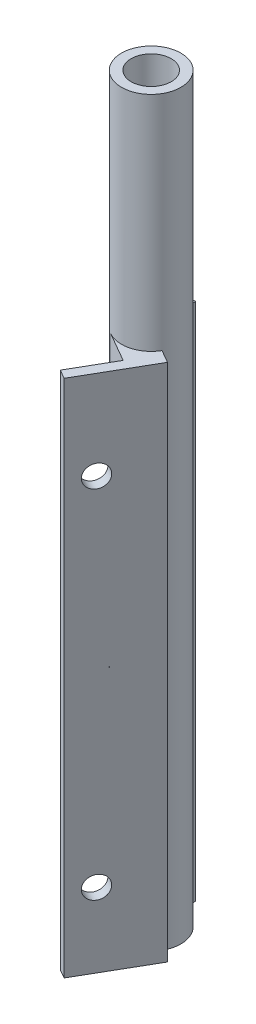
from build123d import *

# Parameters (mm, degrees)
SKETCH1_R           = 5.08
BOSS_EXTRUDE1_DEPTH = 127
SKETCH2_R           = 3.429
CUT_EXTRUDE1_DEPTH  = 128.2030377
BOSS_EXTRUDE2_DEPTH = 88.9
HOLE_CUTS_1_REACH   = 130.439
SKETCH4_R           = 1.905
HOLE_CUTS_2_REACH   = 130.439
SKETCH7_R           = 1.905
CUT_EXTRUDE7_REACH  = 130.439
SKETCH8_W           = 6.604
SKETCH8_H           = 4.572
SKETCH9_W           = 11.684
SKETCH9_H           = 88.9
CUT_EXTRUDE8_DEPTH  = 2.54
SKETCH10_W          = 11.684
SKETCH10_H          = 88.9
CUT_EXTRUDE9_DEPTH  = 2.54
SKETCH11_W          = 6.604
SKETCH11_H          = 88.9
CUT_EXTRUDE10_DEPTH = 1.27
SKETCH13_W          = 6.604
SKETCH13_H          = 88.9
CUT_EXTRUDE11_DEPTH = 1.27
SKETCH14_W          = 1.778
SKETCH14_H          = 88.9
BOSS_EXTRUDE3_DEPTH = 1.27
SKETCH15_W          = 1.778
SKETCH15_H          = 88.9
BOSS_EXTRUDE4_DEPTH = 1.27


with BuildPart() as part:
    # Sketch1 → Boss-Extrude1 (new body)
    with BuildSketch(Plane(origin=(0, 0, 0), x_dir=(1, 0, 0), z_dir=(0, 1, 0))):
        Circle(SKETCH1_R)
    extrude(amount=BOSS_EXTRUDE1_DEPTH)

    # Sketch2 → Cut-Extrude1 (cut, through all)
    with BuildSketch(Plane.XZ):
        Circle(SKETCH2_R)
    extrude(amount=-CUT_EXTRUDE1_DEPTH, mode=Mode.SUBTRACT)

    # Sketch3 → Boss-Extrude2 (add)
    with BuildSketch(Plane.XZ):
        with BuildLine():
            Line((-1.442590949, 12.658640818), (-5.842, 10.118640818))
            Line((-5.842, 10.118640818), (-2.54, 4.399409051))
            ThreePointArc((-2.54, 4.399409051), (2.96960111, -1.7145), (-5.08, 0))
            Line((-5.08, 0), (-11.684, 0))
            Line((-11.684, 0), (-11.684, -5.08))
            Line((-11.684, -5.08), (-11.684, -10.16))
            Line((-11.684, -10.16), (0, -10.16))
            Line((0, -10.16), (0, -5.08))
            ThreePointArc((0, -5.08), (4.399409051, -2.54), (4.399409051, 2.54))
            Line((4.399409051, 2.54), (8.798818102, 5.08))
            Line((8.798818102, 5.08), (2.956818102, 15.198640818))
            Line((2.956818102, 15.198640818), (-1.442590949, 12.658640818))
        make_face()
    extrude(amount=-BOSS_EXTRUDE2_DEPTH)

    # Sketch4 → Hole Cuts 1 (cut, up to next)
    with BuildSketch(Plane.XY, mode=Mode.PRIVATE) as hole_cuts_1_sk1:
        with Locations((-8.89, 81.28)):
            Circle(SKETCH4_R)
    hole_cuts_1_tool1 = extrude(hole_cuts_1_sk1.sketch, amount=-HOLE_CUTS_1_REACH, mode=Mode.PRIVATE) & part.part
    # Sketch4 → Hole Cuts 1 (cut, up to next)
    with BuildSketch(Plane.XY, mode=Mode.PRIVATE) as hole_cuts_1_sk2:
        with Locations((-8.89, 20.32)):
            Circle(SKETCH4_R)
    hole_cuts_1_tool2 = extrude(hole_cuts_1_sk2.sketch, amount=-HOLE_CUTS_1_REACH, mode=Mode.PRIVATE) & part.part
    add(hole_cuts_1_tool1.solids().sort_by_distance((-8.89, 81.28, 0))[0], mode=Mode.SUBTRACT)
    add(hole_cuts_1_tool2.solids().sort_by_distance((-8.89, 20.32, 0))[0], mode=Mode.SUBTRACT)

    # Sketch7 → Hole Cuts 2 (cut, up to next)
    with BuildSketch(Plane(origin=(0, 0, 0), x_dir=(0.49999999999999784, 0, -0.86602540378444), z_dir=(0.86602540378444, 0, 0.49999999999999784)), mode=Mode.PRIVATE) as hole_cuts_2_sk1:
        with Locations((-8.89, 73.66)):
            Circle(SKETCH7_R)
    hole_cuts_2_tool1 = extrude(hole_cuts_2_sk1.sketch, amount=HOLE_CUTS_2_REACH, mode=Mode.PRIVATE) & part.part
    # Sketch7 → Hole Cuts 2 (cut, up to next)
    with BuildSketch(Plane(origin=(0, 0, 0), x_dir=(0.49999999999999784, 0, -0.86602540378444), z_dir=(0.86602540378444, 0, 0.49999999999999784)), mode=Mode.PRIVATE) as hole_cuts_2_sk2:
        with Locations((-8.89, 12.7)):
            Circle(SKETCH7_R)
    hole_cuts_2_tool2 = extrude(hole_cuts_2_sk2.sketch, amount=HOLE_CUTS_2_REACH, mode=Mode.PRIVATE) & part.part
    add(hole_cuts_2_tool1.solids().sort_by_distance((-4.445, 73.66, 7.698966))[0], mode=Mode.SUBTRACT)
    add(hole_cuts_2_tool2.solids().sort_by_distance((-4.445, 12.7, 7.698966))[0], mode=Mode.SUBTRACT)

    # Sketch8 → Cut-Extrude7 (cut, up to next)
    with BuildSketch(Plane.XZ, mode=Mode.PRIVATE) as cut_extrude7_sk1:
        Polygon((-5.842, 10.118640818), (-1.882531854, 12.404640818), (1.419468146, 6.685409051), (-2.54, 4.399409051), align=None)
    cut_extrude7_tool1 = extrude(cut_extrude7_sk1.sketch, amount=-CUT_EXTRUDE7_REACH, mode=Mode.PRIVATE) & part.part
    # Sketch8 → Cut-Extrude7 (cut, up to next)
    with BuildSketch(Plane.XZ, mode=Mode.PRIVATE) as cut_extrude7_sk2:
        with Locations((-8.382, -2.286)):
            Rectangle(SKETCH8_W, SKETCH8_H)
    cut_extrude7_tool2 = extrude(cut_extrude7_sk2.sketch, amount=-CUT_EXTRUDE7_REACH, mode=Mode.PRIVATE) & part.part
    add(cut_extrude7_tool1.solids().sort_by_distance((-2.211266, 0, 8.402025))[0], mode=Mode.SUBTRACT)
    add(cut_extrude7_tool2.solids().sort_by_distance((-8.382, 0, -2.286))[0], mode=Mode.SUBTRACT)

    # Sketch9 → Cut-Extrude8 (cut)
    with BuildSketch(Plane(origin=(0, 0, -10.16), x_dir=(-1, 0, 0), z_dir=(0, 0, -1))):
        with Locations((5.842, 44.45)):
            Rectangle(SKETCH9_W, SKETCH9_H)
    extrude(amount=-CUT_EXTRUDE8_DEPTH, mode=Mode.SUBTRACT)

    # Sketch10 → Cut-Extrude9 (cut)
    with BuildSketch(Plane(origin=(8.798818102, 0, 5.08), x_dir=(0.4999999999999982, 0, -0.8660254037844397), z_dir=(0.8660254037844398, 0, 0.4999999999999983))):
        with Locations((-5.842, 44.45)):
            Rectangle(SKETCH10_W, SKETCH10_H)
    extrude(amount=-CUT_EXTRUDE9_DEPTH, mode=Mode.SUBTRACT)

    # Sketch11 → Cut-Extrude10 (cut)
    with BuildSketch(Plane.XY.offset(-4.572)):
        with Locations((-8.382, 44.45)):
            Rectangle(SKETCH11_W, SKETCH11_H)
    extrude(amount=-CUT_EXTRUDE10_DEPTH, mode=Mode.SUBTRACT)

    # Sketch13 → Cut-Extrude11 (cut)
    with BuildSketch(Plane(origin=(3.959468146, 0, 2.286), x_dir=(-0.5000000000000004, 0, 0.8660254037844384), z_dir=(-0.8660254037844384, 0, -0.5000000000000004))):
        with Locations((8.382, 44.45)):
            Rectangle(SKETCH13_W, SKETCH13_H)
    extrude(amount=-CUT_EXTRUDE11_DEPTH, mode=Mode.SUBTRACT)

    # Sketch14 → Boss-Extrude3 (add)
    with BuildSketch(Plane(origin=(-5.842, 0, 10.118640818), x_dir=(0.8660254037844394, 0, 0.4999999999999989), z_dir=(-0.4999999999999989, 0, 0.8660254037844394))):
        with Locations((6.731, 44.45)):
            Rectangle(SKETCH14_W, SKETCH14_H)
    extrude(amount=BOSS_EXTRUDE3_DEPTH)

    # Sketch15 → Boss-Extrude4 (add)
    with BuildSketch(Plane.ZY.offset(11.684)):
        with Locations((-6.731, 44.45)):
            Rectangle(SKETCH15_W, SKETCH15_H)
    extrude(amount=BOSS_EXTRUDE4_DEPTH)


solid = part.part
